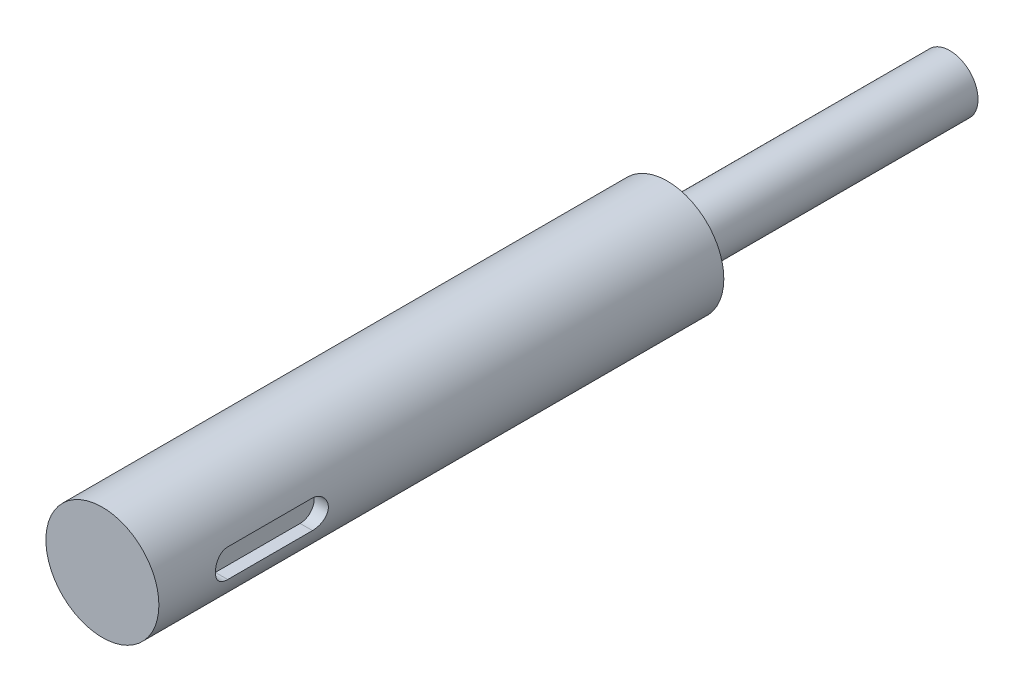
from build123d import *

# Parameters (mm, degrees)
SKETCH_1_R          = 4
EXTRUDE_1_DEPTH     = 40
SKETCH_2_R          = 2
EXTRUDE_2_DEPTH     = 20
CUT_EXTRUDE_1_DEPTH = 41.804411526


with BuildPart() as part:
    # ｽｹｯﾁ1 → ﾎﾞｽ - 押し出し1 (new body)
    with BuildSketch(Plane.XY):
        Circle(SKETCH_1_R)
    extrude(amount=EXTRUDE_1_DEPTH)

    # ｽｹｯﾁ2 → ﾎﾞｽ - 押し出し2 (add)
    with BuildSketch(Plane(origin=(0, 0, 0), x_dir=(-1, 0, 0), z_dir=(0, 0, -1))):
        Circle(SKETCH_2_R)
    extrude(amount=EXTRUDE_2_DEPTH)

    # ｽｹｯﾁ3 → ｶｯﾄ - 押し出し1 (cut, through all)
    with BuildSketch(Plane(origin=(3, 0, 0), x_dir=(0, 0, -1), z_dir=(1, 0, 0))):
        with BuildLine():
            Line((-35, 1), (-29, 1))
            ThreePointArc((-29, 1), (-28, 0), (-29, -1))
            Line((-29, -1), (-35, -1))
            ThreePointArc((-35, -1), (-36, 0), (-35, 1))
        make_face()
    extrude(amount=CUT_EXTRUDE_1_DEPTH, mode=Mode.SUBTRACT)


solid = part.part
